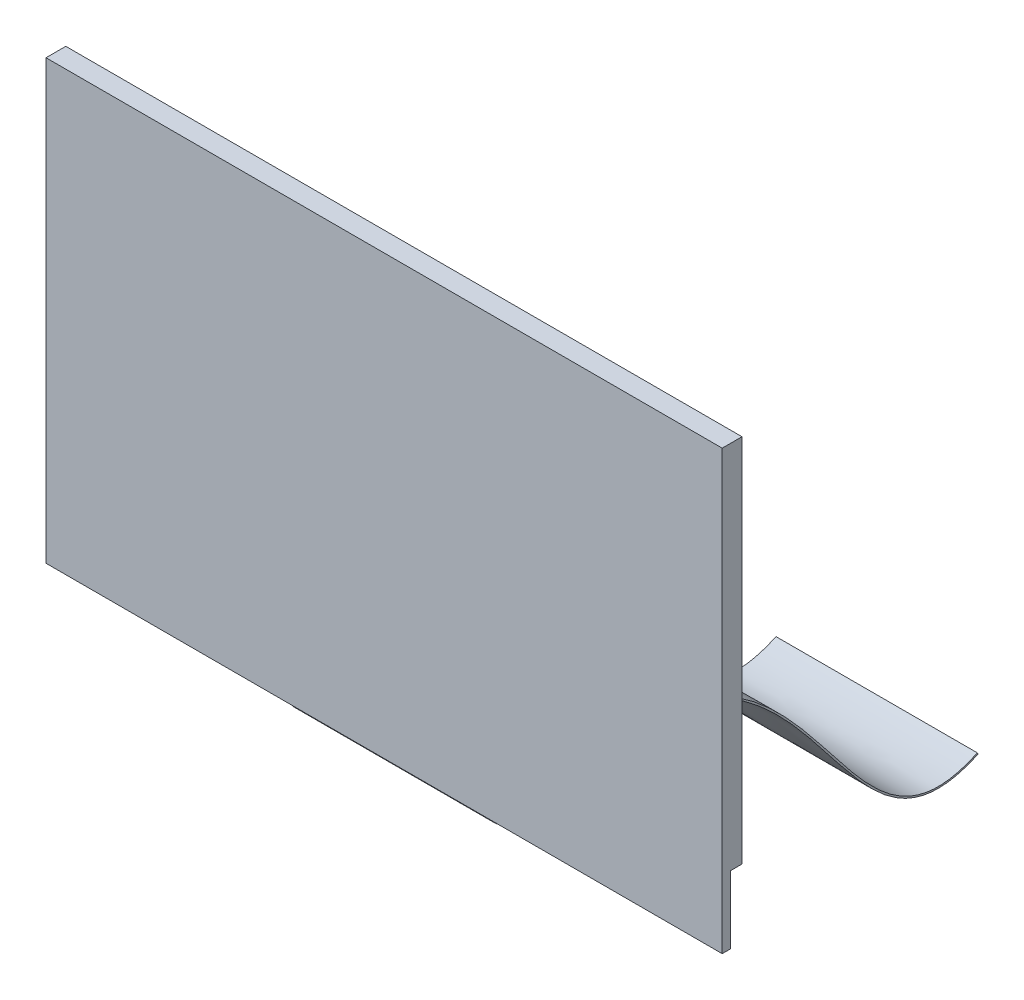
from build123d import *

# Parameters (mm, degrees)
SKETCH_1_W          = 42.04
SKETCH_1_H          = 27.22
EXTRUDE_1_DEPTH     = 0.52
SKETCH_3_W          = 42.04
SKETCH_3_H          = 23.01
EXTRUDE_2_DEPTH     = 0.71
SKETCH_5_W          = 35.05
SKETCH_5_H          = 15.32
CUT_EXTRUDE_1_DEPTH = 0.01
EXTRUDE_START       = -6.26
EXTRUDE_1_2_DEPTH   = 12.52


# Read off the part's stored shape, not the designer's step: 拉伸-薄壁1
with BuildPart() as part:
    # 草图1 → Extrude 1 (new body)
    with BuildSketch(Plane.XY):
        Rectangle(SKETCH_1_W, SKETCH_1_H)
    extrude(amount=EXTRUDE_1_DEPTH)

    # 草图3 → 凸台-拉伸2 (add)
    with BuildSketch(Plane.XY):
        with Locations((0, 2.105)):
            Rectangle(SKETCH_3_W, SKETCH_3_H)
    extrude(amount=-EXTRUDE_2_DEPTH)

    # 草图5 → 切除-拉伸1 (cut)
    with BuildSketch(Plane.XY):
        with Locations((0, 2.105)):
            Rectangle(SKETCH_5_W, SKETCH_5_H)
    extrude(amount=-CUT_EXTRUDE_1_DEPTH, mode=Mode.SUBTRACT)

    # Extrude 1 2 outline → Extrude 1 2 (add)
    with BuildSketch(Plane(origin=(0, 0, 0), x_dir=(0, 0, -1), z_dir=(1, 0, 0)).offset(EXTRUDE_START)):
        with BuildLine():
            Line((0, -13.61), (-0.1, -13.61))
            add(Edge.make_bspline(
                [(-0.1, -13.61), (-0.1, -13.811999948), (-0.062447397, -13.983759134), (0.087597414, -14.266880112), (0.200229868, -14.375905512), (0.61293299, -14.604541747), (0.98162629, -14.634564325), (2.275338874, -14.53538179), (3.401387146, -14.206264697), (4.808904257, -13.842712132), (5.090182683, -13.77233657), (5.643385338, -13.645546605), (5.91499808, -13.589621122), (6.715455086, -13.444072044), (7.229865116, -13.376385405), (8.718879461, -13.254443705), (9.639245367, -13.281281386), (12.212088444, -13.631316764), (13.676832265, -14.22370802), (16.256955878, -15.84390487), (17.371964057, -16.872230984), (20.403860489, -20.184886502), (22.003130479, -22.695949544), (24.648389829, -25.189380489), (25.574110216, -25.809694734), (27.660843497, -26.317217871), (28.817134045, -26.200070844), (30.142790661, -25.575336117)],
                knots=[0, 0, 0, 0, 0.015625, 0.015625, 0.03125, 0.03125, 0.0625, 0.0625, 0.125, 0.125, 0.140625, 0.140625, 0.15625, 0.15625, 0.1875, 0.1875, 0.25, 0.25, 0.375, 0.375, 0.5, 0.5, 0.75, 0.75, 0.875, 0.875, 1, 1, 1, 1], degree=3))
            Line((30.142790661, -25.575336117), (30.100160891, -25.484877824))
            add(Edge.make_bspline(
                [(0, -13.61), (0, -15.345647415), (20.557920243, -6.954998075), (21.119775691, -29.717013379), (30.100160891, -25.484877824)],
                knots=[0, 0, 0, 0, 0.142988606, 1, 1, 1, 1], degree=3))
        make_face()
    extrude(amount=EXTRUDE_1_2_DEPTH)


solid = part.part
